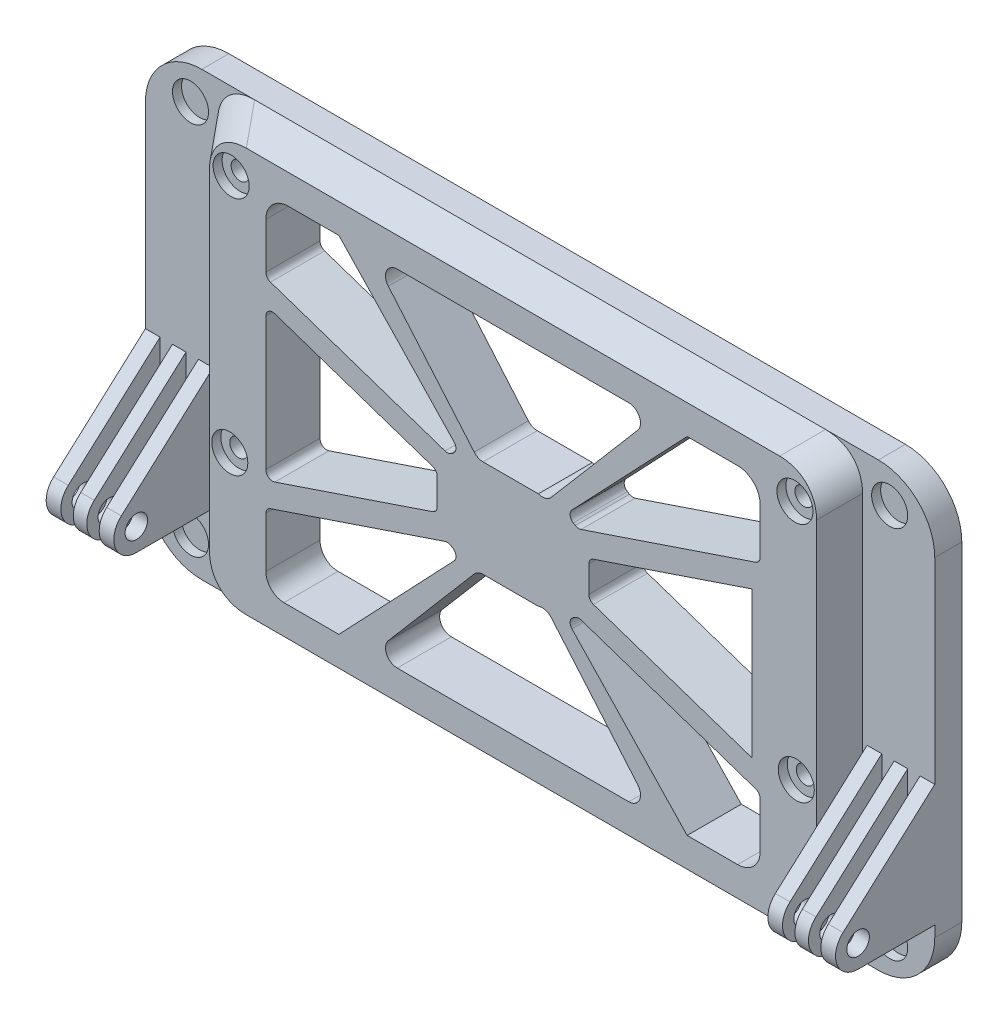
from build123d import *
from OCP.BRepFilletAPI import BRepFilletAPI_MakeChamfer

# Parameters (mm, degrees)
BOSS_EXTRUDE1_DEPTH = 6
SKETCH2_R           = 4
CUT_EXTRUDE1_DEPTH  = 2
SKETCH3_W           = 143
SKETCH3_H           = 98
BOSS_EXTRUDE2_DEPTH = 6
CHAMFER1_SIZE       = 6
CHAMFER1_SIZE_2     = 4.201245229
FILLET1_R           = 10
CUT_EXTRUDE3_DEPTH  = 102.001237616
SKETCH5_R           = 4
CUT_EXTRUDE4_DEPTH  = 2
SKETCH6_R           = 2
CUT_EXTRUDE5_DEPTH  = 101.783183121
SKETCH7_R           = 2.5
BOSS_EXTRUDE3_DEPTH = 15
SKETCH8_W           = 2.75
SKETCH8_H           = 27
CUT_EXTRUDE7_DEPTH  = 103.670589752


# Some blends are built 0.0001 mm under size
with BuildPart() as part:
    # Sketch1 → Boss-Extrude1 (new body)
    with BuildSketch(Plane.XY):
        with BuildLine():
            Line((-75, -49), (75, -49))
            ThreePointArc((75, -49), (83.838834765, -45.338834765), (87.5, -36.5))
            Line((87.5, -36.5), (87.5, 36.5))
            ThreePointArc((87.5, 36.5), (83.838834765, 45.338834765), (75, 49))
            Line((75, 49), (-75, 49))
            ThreePointArc((-75, 49), (-83.838834765, 45.338834765), (-87.5, 36.5))
            Line((-87.5, 36.5), (-87.5, -36.5))
            ThreePointArc((-87.5, -36.5), (-83.838834765, -45.338834765), (-75, -49))
        make_face()
    extrude(amount=BOSS_EXTRUDE1_DEPTH)

    # Sketch2 → Cut-Extrude1 (cut)
    with BuildSketch(Plane.XY.offset(6)):
        with Locations((-77.5, -41.5)):
            Circle(SKETCH2_R)
        with Locations((-77.5, 41.5)):
            Circle(SKETCH2_R)
        with Locations((77.5, 41.5)):
            Circle(SKETCH2_R)
        with Locations((77.5, -41.5)):
            Circle(SKETCH2_R)
    extrude(amount=-CUT_EXTRUDE1_DEPTH, mode=Mode.SUBTRACT)

    # Sketch3 → Boss-Extrude2 (add)
    with BuildSketch(Plane.XY.offset(6)):
        Rectangle(SKETCH3_W, SKETCH3_H)
    extrude(amount=BOSS_EXTRUDE2_DEPTH)

    # Chamfer1
    chamfer1_edges_1 = [part.edges().sort_by_distance(p)[0] for p in [
        (0, -49, 12),
    ]]
    chamfer1_side_1 = [part.faces().sort_by_distance(p)[0] for p in [
        (0, -49, 11.915975095),
    ]]
    chamfer1_edges_2 = [part.edges().sort_by_distance(p)[0] for p in [
        (71.5, 0, 12),
    ]]
    chamfer1_side_2 = [part.faces().sort_by_distance(p)[0] for p in [
        (71.5, 0, 11.915975095),
    ]]
    chamfer1_edges_3 = [part.edges().sort_by_distance(p)[0] for p in [
        (0, 49, 12),
    ]]
    chamfer1_side_3 = [part.faces().sort_by_distance(p)[0] for p in [
        (0, 49, 11.915975095),
    ]]
    chamfer1_edges_4 = [part.edges().sort_by_distance(p)[0] for p in [
        (-71.5, 0, 12),
    ]]
    chamfer1_side_4 = [part.faces().sort_by_distance(p)[0] for p in [
        (-71.5, 0, 11.915975095),
    ]]
    chamfer1 = BRepFilletAPI_MakeChamfer(part.part.solid().wrapped)
    for e in chamfer1_edges_1:
        chamfer1.Add(CHAMFER1_SIZE - 0.0001, CHAMFER1_SIZE_2 - 0.0001, e.wrapped, chamfer1_side_1[0].wrapped)
    for e in chamfer1_edges_2:
        chamfer1.Add(CHAMFER1_SIZE - 0.0001, CHAMFER1_SIZE_2 - 0.0001, e.wrapped, chamfer1_side_2[0].wrapped)
    for e in chamfer1_edges_3:
        chamfer1.Add(CHAMFER1_SIZE - 0.0001, CHAMFER1_SIZE_2 - 0.0001, e.wrapped, chamfer1_side_3[0].wrapped)
    for e in chamfer1_edges_4:
        chamfer1.Add(CHAMFER1_SIZE - 0.0001, CHAMFER1_SIZE_2 - 0.0001, e.wrapped, chamfer1_side_4[0].wrapped)
    add(Compound.cast(chamfer1.Shape()), mode=Mode.REPLACE)  # a hair under: the kernel refuses the full size

    # Fillet1
    # the kernel refuses this fillet: 10 mm, written as the material it takes off along each edge
    with BuildSketch(Plane(origin=(-80.338409297, 57.838409297, -6.622546695), x_dir=(-0.2853764384321531, -0.8674404497677589, -0.40756270007753115), z_dir=(0.4975410195217164, -0.4975410195217155, 0.7105672858966862))) as fillet1_piece_1_section:
        with BuildLine():
            CenterArc((FILLET1_R * 0.710567285897, FILLET1_R), FILLET1_R, 199.207288567, 70.792711433)
            Line((-FILLET1_R * 0.23376724174, FILLET1_R * 0.671013222281), (0, 0))
            Line((0, 0), (FILLET1_R * 0.710567285897, 0))
        make_face()
    fillet1_piece_1 = extrude(amount=43.972181114, mode=Mode.PRIVATE)
    fillet1_piece_1 = split(fillet1_piece_1, bisect_by=Plane(origin=(-66.037388374, 46.592299242, 6), z_dir=(0, 0, 1)), keep=Keep.TOP, mode=Mode.PRIVATE)
    add(fillet1_piece_1, mode=Mode.SUBTRACT)
    with BuildSketch(Plane(origin=(80.338409297, 57.838409297, -6.622546695), x_dir=(0.28537643843215343, -0.8674404497677589, -0.4075627000775309), z_dir=(-0.4975410195217164, -0.4975410195217155, 0.7105672858966862))) as fillet1_piece_2_section:
        with BuildLine():
            CenterArc((FILLET1_R * 0.710567285897, -FILLET1_R), FILLET1_R, 90, 70.792711433)
            Line((-FILLET1_R * 0.23376724174, -FILLET1_R * 0.671013222281), (0, 0))
            Line((0, 0), (FILLET1_R * 0.710567285897, 0))
        make_face()
    fillet1_piece_2 = extrude(amount=43.972181114, mode=Mode.PRIVATE)
    fillet1_piece_2 = split(fillet1_piece_2, bisect_by=Plane(origin=(66.037388419, 46.592299255, 6), z_dir=(0, 0, 1)), keep=Keep.TOP, mode=Mode.PRIVATE)
    add(fillet1_piece_2, mode=Mode.SUBTRACT)
    with BuildSketch(Plane(origin=(-80.338409297, -57.838409297, -6.622546695), x_dir=(0.8674404497677584, -0.28537643843215443, -0.4075627000775313), z_dir=(0.4975410195217164, 0.4975410195217155, 0.7105672858966862))) as fillet1_piece_3_section:
        with BuildLine():
            CenterArc((FILLET1_R * 0.710567285897, FILLET1_R), FILLET1_R, 199.207288567, 70.792711433)
            Line((-FILLET1_R * 0.23376724174, FILLET1_R * 0.671013222281), (0, 0))
            Line((0, 0), (FILLET1_R * 0.710567285897, 0))
        make_face()
    fillet1_piece_3 = extrude(amount=43.972181114, mode=Mode.PRIVATE)
    fillet1_piece_3 = split(fillet1_piece_3, bisect_by=Plane(origin=(-68.349851216, -44.516567652, 6), z_dir=(0, 0, 1)), keep=Keep.TOP, mode=Mode.PRIVATE)
    add(fillet1_piece_3, mode=Mode.SUBTRACT)
    with BuildSketch(Plane(origin=(80.338409297, -57.838409297, -6.622546695), x_dir=(-0.8674404497677585, -0.285376438432154, -0.40756270007753165), z_dir=(-0.4975410195217164, 0.4975410195217155, 0.7105672858966862))) as fillet1_piece_4_section:
        with BuildLine():
            CenterArc((FILLET1_R * 0.710567285897, -FILLET1_R), FILLET1_R, 90, 70.792711433)
            Line((-FILLET1_R * 0.23376724174, -FILLET1_R * 0.671013222281), (0, 0))
            Line((0, 0), (FILLET1_R * 0.710567285897, 0))
        make_face()
    fillet1_piece_4 = extrude(amount=43.972181114, mode=Mode.PRIVATE)
    fillet1_piece_4 = split(fillet1_piece_4, bisect_by=Plane(origin=(66.037387865, -46.592298857, 6), z_dir=(0, 0, 1)), keep=Keep.TOP, mode=Mode.PRIVATE)
    add(fillet1_piece_4, mode=Mode.SUBTRACT)

    # Sketch4 → Cut-Extrude3 (cut, through all)
    with BuildSketch(Plane.XY.offset(12)):
        with BuildLine():
            Line((38.605374144, -38.298754771), (49.798754771, -38.298754771))
            ThreePointArc((49.798754771, -38.298754771), (53.334288677, -36.834288677), (54.798754771, -33.298754771))
            Line((54.798754771, -33.298754771), (54.798754771, -23.169947538))
            ThreePointArc((54.798754771, -23.169947538), (54.517258351, -22.295162407), (53.778422737, -21.748709119))
            Line((53.778422737, -21.748709119), (15.078026844, -8.687325505))
            ThreePointArc((15.078026844, -8.687325505), (14.435139445, -8.617470561), (13.822587932, -8.824749513))
            Line((13.822587932, -8.824749513), (13.374891952, -9.095278907))
            ThreePointArc((13.374891952, -9.095278907), (12.664057709, -10.179080781), (13.063163747, -11.41221751))
            Line((13.063163747, -11.41221751), (38.605374144, -38.298754771))
        make_face()
        with BuildLine():
            ThreePointArc((52.819086805, -16.156862061), (52.908782166, -16.184043944), (53, -16.205571121))
            Line((53, -16.205571121), (53, 16.205571121))
            ThreePointArc((53, 16.205571121), (52.908782166, 16.184043944), (52.819086805, 16.156862061))
            Line((52.819086805, 16.156862061), (17.819086805, 4.344362061))
            ThreePointArc((17.819086805, 4.344362061), (17.080251191, 3.797908774), (16.798754771, 2.923123643))
            Line((16.798754771, 2.923123643), (16.798754771, -2.923123643))
            ThreePointArc((16.798754771, -2.923123643), (17.080251191, -3.797908774), (17.819086805, -4.344362061))
            Line((17.819086805, -4.344362061), (52.819086805, -16.156862061))
        make_face()
        with BuildLine():
            ThreePointArc((54.798754771, 33.298754771), (53.334288677, 36.834288677), (49.798754771, 38.298754771))
            Line((49.798754771, 38.298754771), (38.605374144, 38.298754771))
            Line((38.605374144, 38.298754771), (13.063163747, 11.41221751))
            ThreePointArc((13.063163747, 11.41221751), (12.664057709, 10.179080781), (13.374891952, 9.095278907))
            Line((13.374891952, 9.095278907), (13.822587932, 8.824749513))
            ThreePointArc((13.822587932, 8.824749513), (14.435139445, 8.617470561), (15.078026844, 8.687325505))
            Line((15.078026844, 8.687325505), (53.778422737, 21.748709119))
            ThreePointArc((53.778422737, 21.748709119), (54.517258351, 22.295162407), (54.798754771, 23.169947538))
            Line((54.798754771, 23.169947538), (54.798754771, 33.298754771))
        make_face()
        with BuildLine():
            Line((-50.798754771, -38.298754771), (-38.605374144, -38.298754771))
            Line((-38.605374144, -38.298754771), (-13.063163747, -11.41221751))
            ThreePointArc((-13.063163747, -11.41221751), (-12.664057709, -10.179080781), (-13.374891952, -9.095278907))
            Line((-13.374891952, -9.095278907), (-13.822587932, -8.824749513))
            ThreePointArc((-13.822587932, -8.824749513), (-14.435139445, -8.617470561), (-15.078026844, -8.687325505))
            Line((-15.078026844, -8.687325505), (-53.778422737, -21.748709119))
            ThreePointArc((-53.778422737, -21.748709119), (-54.517258351, -22.295162407), (-54.798754771, -23.169947538))
            Line((-54.798754771, -23.169947538), (-54.798754771, -34.298754771))
            ThreePointArc((-54.798754771, -34.298754771), (-53.627181895, -37.127181895), (-50.798754771, -38.298754771))
        make_face()
        with BuildLine():
            ThreePointArc((27.647216151, 34.02650079), (28.0286641, 36.793302965), (25.67615232, 38.298754771))
            Line((25.67615232, 38.298754771), (-25.67615232, 38.298754771))
            ThreePointArc((-25.67615232, 38.298754771), (-28.0286641, 36.793302965), (-27.647216151, 34.02650079))
            Line((-27.647216151, 34.02650079), (-8.608281569, 11.708132501))
            ThreePointArc((-8.608281569, 11.708132501), (-7.722581788, 11.037058846), (-6.637217738, 10.798754771))
            Line((-6.637217738, 10.798754771), (5.606032866, 10.798754771))
            ThreePointArc((5.606032866, 10.798754771), (7.156866017, 10.723579297), (8.47218991, 11.548599216))
            Line((8.47218991, 11.548599216), (27.647216151, 34.02650079))
        make_face()
        with BuildLine():
            Line((-16.798754771, -2.923123643), (-16.798754771, 2.923123643))
            ThreePointArc((-16.798754771, 2.923123643), (-17.080251191, 3.797908774), (-17.819086805, 4.344362061))
            Line((-17.819086805, 4.344362061), (-52.819086805, 16.156862061))
            ThreePointArc((-52.819086805, 16.156862061), (-54.173539902, 15.954127223), (-54.798754771, 14.735623643))
            Line((-54.798754771, 14.735623643), (-54.798754771, -14.735623643))
            ThreePointArc((-54.798754771, -14.735623643), (-54.173539902, -15.954127223), (-52.819086805, -16.156862061))
            Line((-52.819086805, -16.156862061), (-17.819086805, -4.344362061))
            ThreePointArc((-17.819086805, -4.344362061), (-17.080251191, -3.797908774), (-16.798754771, -2.923123643))
        make_face()
        with BuildLine():
            ThreePointArc((25.67615232, -38.298754771), (28.0286641, -36.793302965), (27.647216151, -34.02650079))
            Line((27.647216151, -34.02650079), (8.47218991, -11.548599216))
            ThreePointArc((8.47218991, -11.548599216), (7.156866017, -10.723579297), (5.606032866, -10.798754771))
            Line((5.606032866, -10.798754771), (-6.637217738, -10.798754771))
            ThreePointArc((-6.637217738, -10.798754771), (-7.722581788, -11.037058846), (-8.608281569, -11.708132501))
            Line((-8.608281569, -11.708132501), (-27.647216151, -34.02650079))
            ThreePointArc((-27.647216151, -34.02650079), (-28.0286641, -36.793302965), (-25.67615232, -38.298754771))
            Line((-25.67615232, -38.298754771), (25.67615232, -38.298754771))
        make_face()
        with BuildLine():
            Line((-13.063163747, 11.41221751), (-38.605374144, 38.298754771))
            Line((-38.605374144, 38.298754771), (-49.798754771, 38.298754771))
            ThreePointArc((-49.798754771, 38.298754771), (-53.334288677, 36.834288677), (-54.798754771, 33.298754771))
            Line((-54.798754771, 33.298754771), (-54.798754771, 23.169947538))
            ThreePointArc((-54.798754771, 23.169947538), (-54.517258351, 22.295162407), (-53.778422737, 21.748709119))
            Line((-53.778422737, 21.748709119), (-15.078026844, 8.687325505))
            ThreePointArc((-15.078026844, 8.687325505), (-14.435139445, 8.617470561), (-13.822587932, 8.824749513))
            Line((-13.822587932, 8.824749513), (-13.374891952, 9.095278907))
            ThreePointArc((-13.374891952, 9.095278907), (-12.664057709, 10.179080781), (-13.063163747, 11.41221751))
        make_face()
    extrude(amount=-CUT_EXTRUDE3_DEPTH, mode=Mode.SUBTRACT)

    # Sketch5 → Cut-Extrude4 (cut)
    with BuildSketch(Plane.XY.offset(12)):
        with Locations((62.498754771, 37.798754771)):
            Circle(SKETCH5_R)
        with Locations((-62.498754771, 37.798754771)):
            Circle(SKETCH5_R)
        with Locations((62.798754771, -15.500400945)):
            Circle(SKETCH5_R)
        with Locations((-62.798754771, -15.500400945)):
            Circle(SKETCH5_R)
    extrude(amount=-CUT_EXTRUDE4_DEPTH, mode=Mode.SUBTRACT)

    # Sketch6 → Cut-Extrude5 (cut, through all)
    with BuildSketch(Plane.XY.offset(10)):
        with Locations((62.498754771, 37.798754771)):
            Circle(SKETCH6_R)
        with Locations((62.798754771, -15.500400945)):
            Circle(SKETCH6_R)
        with Locations((-62.798754771, -15.500400945)):
            Circle(SKETCH6_R)
        with Locations((-62.498754771, 37.798754771)):
            Circle(SKETCH6_R)
    extrude(amount=-CUT_EXTRUDE5_DEPTH, mode=Mode.SUBTRACT)

    # Sketch7 → Boss-Extrude3 (add)
    with BuildSketch(Plane.ZY.offset(87.5)):
        with BuildLine():
            Line((6, -34.043359763), (23, -34.043359763))
            ThreePointArc((23, -34.043359763), (27.668754358, -30.832977807), (26.342114816, -25.32445286))
            Line((26.342114816, -25.32445286), (6, -7.043359763))
            Line((6, -7.043359763), (6, -34.043359763))
        make_face()
        with Locations((23, -29.043359763)):
            Circle(SKETCH7_R, mode=Mode.SUBTRACT)
    boss_extrude3 = extrude(amount=-BOSS_EXTRUDE3_DEPTH)

    # Sketch8 → Cut-Extrude7 (cut, through all)
    with BuildSketch(Plane.XY.offset(6)):
        with Locations((-82.875, -20.543359763)):
            Rectangle(SKETCH8_W, SKETCH8_H)
        with Locations((-77.125, -20.543359763)):
            Rectangle(SKETCH8_W, SKETCH8_H)
    cut_extrude7 = extrude(amount=CUT_EXTRUDE7_DEPTH, mode=Mode.SUBTRACT)

    # Mirror6: Boss-Extrude3, Cut-Extrude7 across plane
    add(boss_extrude3.mirror(Plane(origin=(0, 0, 0), x_dir=(0, 0, 1), z_dir=(1, 0, 0))))
    add(cut_extrude7.mirror(Plane(origin=(0, 0, 0), x_dir=(0, 0, 1), z_dir=(1, 0, 0))), mode=Mode.SUBTRACT)


solid = part.part
